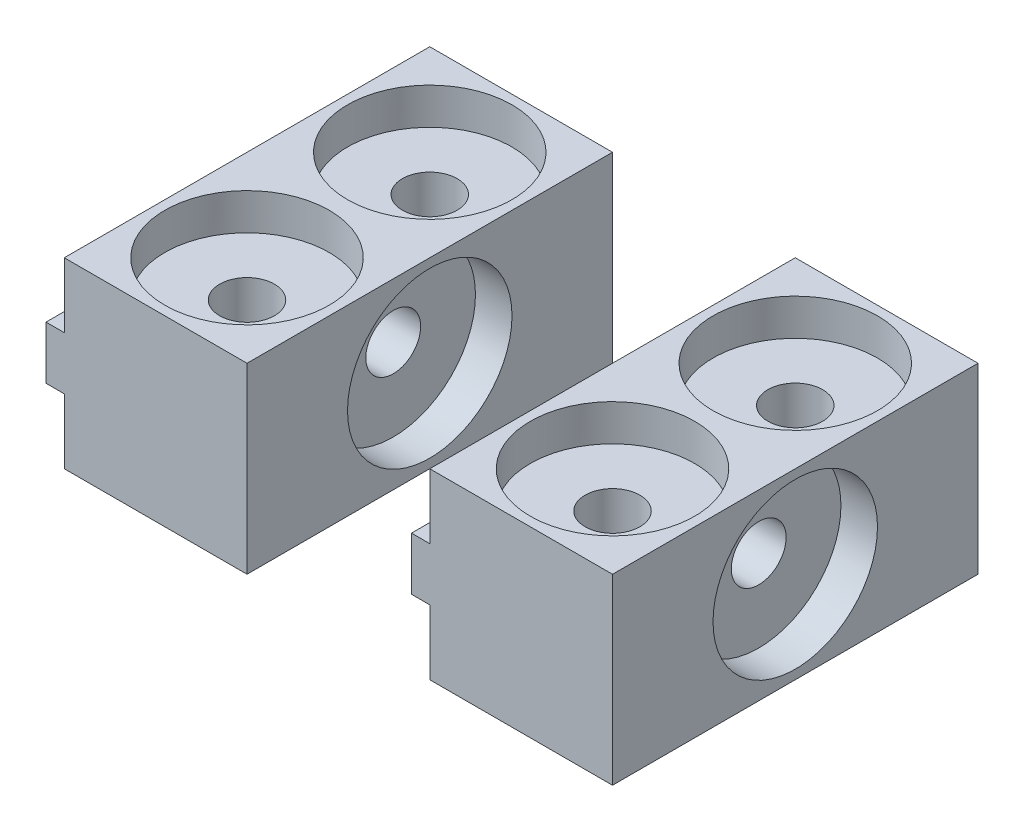
from build123d import *

# Parameters (mm, degrees)
BOSS_EXTRUDE1_DEPTH = 20
SKETCH2_R           = 1.5
CUT_EXTRUDE1_DEPTH  = 25.919871589
SKETCH3_R           = 4.5
CUT_EXTRUDE2_DEPTH  = 2
SKETCH4_R           = 1.5
CUT_EXTRUDE3_DEPTH  = 25.103941586
SKETCH6_R           = 4.5
CUT_EXTRUDE4_DEPTH  = 2
LPATTERN1_COUNT     = 2
LPATTERN1_PITCH     = 10
LPATTERN3_COUNT     = 2
LPATTERN3_PITCH     = 20


with BuildPart() as part:
    # Sketch1 → Boss-Extrude1 (new body)
    with BuildSketch(Plane.XY):
        Polygon((-10, 0), (-10, -3.55), (-11, -3.55), (-11, -6.45), (-10, -6.45), (-10, -10), (0, -10), (0, 0), align=None)
    extrude(amount=BOSS_EXTRUDE1_DEPTH)

    # Sketch2 → Cut-Extrude1 (cut, through all)
    with BuildSketch(Plane(origin=(0, 0, 0), x_dir=(1, 0, 0), z_dir=(0, 1, 0))):
        with Locations((-5, -15)):
            Circle(SKETCH2_R)
    cut_extrude1 = extrude(amount=-CUT_EXTRUDE1_DEPTH, mode=Mode.SUBTRACT)

    # Sketch3 → Cut-Extrude2 (cut)
    with BuildSketch(Plane(origin=(0, 0, 0), x_dir=(0, 0, -1), z_dir=(1, 0, 0))):
        with Locations((-10, -5)):
            Circle(SKETCH3_R)
    extrude(amount=-CUT_EXTRUDE2_DEPTH, mode=Mode.SUBTRACT)

    # Sketch4 → Cut-Extrude3 (cut, through all)
    with BuildSketch(Plane(origin=(-2, 0, 0), x_dir=(0, 0, -1), z_dir=(1, 0, 0))):
        with Locations((-10, -5)):
            Circle(SKETCH4_R)
    extrude(amount=-CUT_EXTRUDE3_DEPTH, mode=Mode.SUBTRACT)

    # Sketch6 → Cut-Extrude4 (cut)
    with BuildSketch(Plane(origin=(0, 0, 0), x_dir=(1, 0, 0), z_dir=(0, 1, 0))):
        with Locations((-5, -15)):
            Circle(SKETCH6_R)
    cut_extrude4 = extrude(amount=-CUT_EXTRUDE4_DEPTH, mode=Mode.SUBTRACT)

    # LPattern1: Cut-Extrude1, Cut-Extrude4 ×2
    with Locations(*[(0, 0, -i * LPATTERN1_PITCH) for i in range(1, LPATTERN1_COUNT)]):
        add(cut_extrude1, mode=Mode.SUBTRACT)
        add(cut_extrude4, mode=Mode.SUBTRACT)


with BuildPart() as lpattern3_1:
    # LPattern3: pattern copy
    add(part.part.moved(Location(Vector(-1, 0, 0) * (1 * LPATTERN3_PITCH))))


solid = Compound([part.part, lpattern3_1.part])
